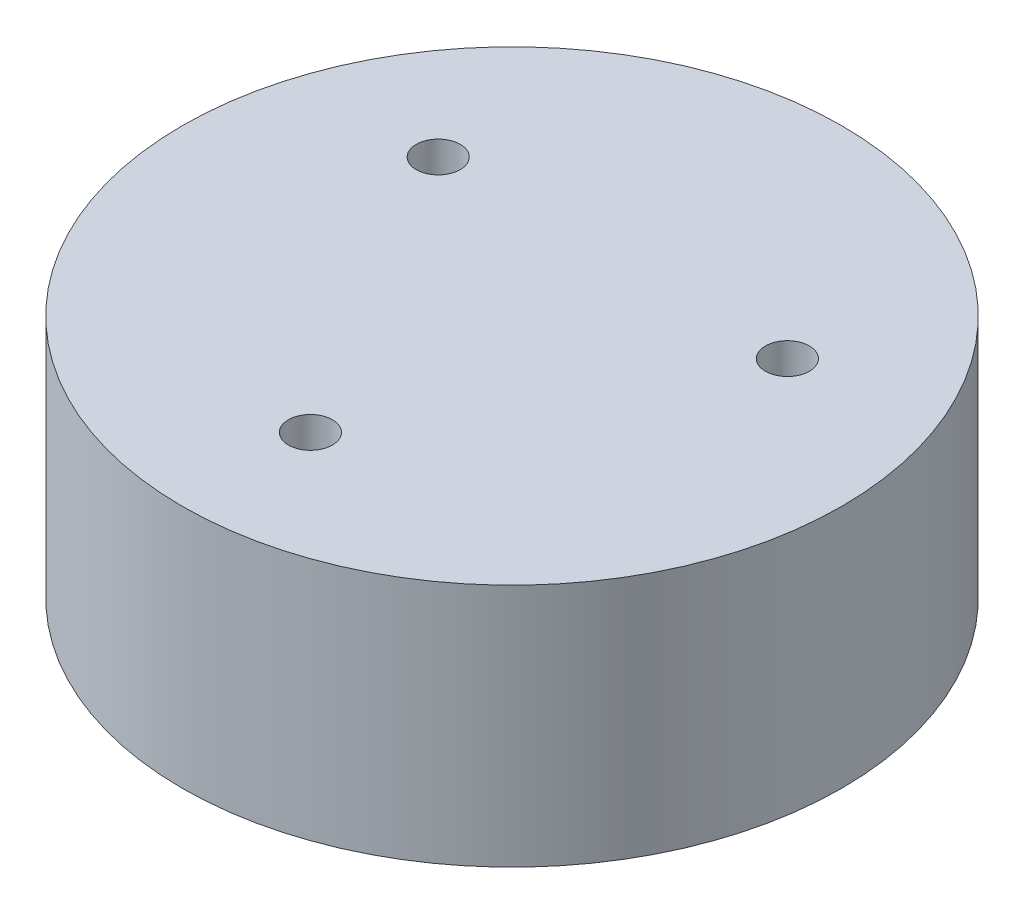
from build123d import *
from OCP.BRepFilletAPI import BRepFilletAPI_MakeChamfer

# Parameters (mm, degrees)
SKETCH2_R                     = 27
BOSS_EXTRUDE2_DEPTH           = 20
CBORE_FOR_M3_SHCS1_AT_2_COUNT = 2
CBORE_FOR_M3_SHCS1_AT_2_PITCH = 28.596158833
CBORE_FOR_M3_SHCS1_AT_3_COUNT = 2
CBORE_FOR_M3_SHCS1_AT_3_PITCH = 28.596158833
HOLE1_D                       = 6.4
HOLE1_DEPTH                   = 15
HOLE1_CBORE_D                 = 7.3
HOLE1_CBORE_DEPTH             = 2
CHAMFER1_SIZE                 = 2
CHAMFER1_SIZE_2               = 0.45


with BuildPart() as part:
    # Sketch2 → Boss-Extrude2 (new body)
    with BuildSketch(Plane(origin=(0, 0, 0), x_dir=(1, 0, 0), z_dir=(0, 1, 0))):
        with Locations(Location((0, 0, 0), (0, 0, 270))):
            Circle(SKETCH2_R)
    extrude(amount=BOSS_EXTRUDE2_DEPTH)

    # Sketch5 → CBORE for M3 SHCS1 (revolve, cut)
    with BuildSketch(Plane(origin=(0, 0, 16.51), x_dir=(0, 0, -1), z_dir=(1, 0, 0))):
        Polygon((0, 0), (0, 20), (1.8, 20), (1.8, 16), (3.25, 16), (3.25, 0.025), (3.275, 0), align=None)
    cbore_for_m3_shcs1 = revolve(axis=Axis((0, -6.35, 16.51), (0, 1, 0)), mode=Mode.SUBTRACT)

    # CBORE for M3 SHCS1 at 2: CBORE for M3 SHCS1 ×2
    with Locations(*[Vector(0.5000000000000012, 0, -0.8660254037844379) * (i * CBORE_FOR_M3_SHCS1_AT_2_PITCH) for i in range(1, CBORE_FOR_M3_SHCS1_AT_2_COUNT)]):
        add(cbore_for_m3_shcs1, mode=Mode.SUBTRACT)

    # CBORE for M3 SHCS1 at 3: CBORE for M3 SHCS1 ×2
    with Locations(*[Vector(-0.4999999999999978, 0, -0.8660254037844399) * (i * CBORE_FOR_M3_SHCS1_AT_3_PITCH) for i in range(1, CBORE_FOR_M3_SHCS1_AT_3_COUNT)]):
        add(cbore_for_m3_shcs1, mode=Mode.SUBTRACT)

    # Hole1
    with Locations(Plane(origin=(0, 0, 0), x_dir=(-1, 0, 0), z_dir=(0, -1, 0))):
        with Locations((14.298079416, -8.255), (0, 16.51), (-14.298079416, -8.255)):
            CounterBoreHole(HOLE1_D / 2, HOLE1_CBORE_D / 2, HOLE1_CBORE_DEPTH, depth=HOLE1_DEPTH)

    # Chamfer1
    chamfer1_edges_1 = [part.edges().sort_by_distance(p)[0] for p in [
        (17.948079416, 2, 8.255),
    ]]
    chamfer1_side_1 = [part.faces().sort_by_distance(p)[0] for p in [
        (17.948079416, 1.991, 8.255),
    ]]
    chamfer1_edges_2 = [part.edges().sort_by_distance(p)[0] for p in [
        (3.65, 2, -16.51),
    ]]
    chamfer1_side_2 = [part.faces().sort_by_distance(p)[0] for p in [
        (3.65, 1.991, -16.51),
    ]]
    chamfer1_edges_3 = [part.edges().sort_by_distance(p)[0] for p in [
        (-10.648079416, 2, 8.255),
    ]]
    chamfer1_side_3 = [part.faces().sort_by_distance(p)[0] for p in [
        (-10.648079416, 1.991, 8.255),
    ]]
    chamfer1 = BRepFilletAPI_MakeChamfer(part.part.solid().wrapped)
    for e in chamfer1_edges_1:
        chamfer1.Add(CHAMFER1_SIZE - 0.0001, CHAMFER1_SIZE_2 - 0.0001, e.wrapped, chamfer1_side_1[0].wrapped)
    for e in chamfer1_edges_2:
        chamfer1.Add(CHAMFER1_SIZE - 0.0001, CHAMFER1_SIZE_2 - 0.0001, e.wrapped, chamfer1_side_2[0].wrapped)
    for e in chamfer1_edges_3:
        chamfer1.Add(CHAMFER1_SIZE - 0.0001, CHAMFER1_SIZE_2 - 0.0001, e.wrapped, chamfer1_side_3[0].wrapped)
    add(Compound.cast(chamfer1.Shape()), mode=Mode.REPLACE)  # a hair under: the kernel refuses the full size


solid = part.part
